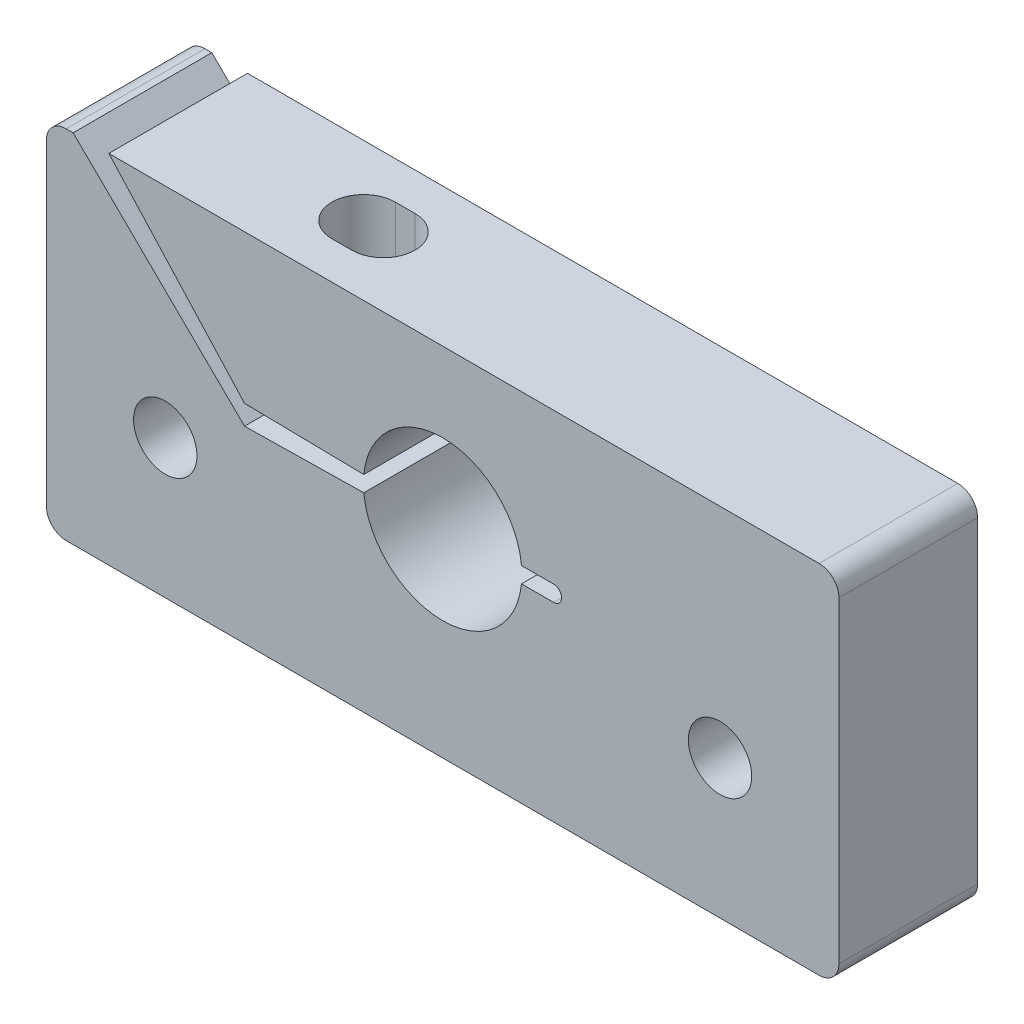
from build123d import *

# Parameters (mm, degrees)
BOSS_EXTRUDE1_DEPTH      = 3.5
BOSS_EXTRUDE1_DEPTH_BACK = 3.5
SKETCH1_R                = 1.6
CUT_EXTRUDE1_REACH       = 29.134
SKETCH3_R                = 1.6
SKETCH3_3_R              = 2.2
SKETCH3_3_R_2            = 1.6
CUT_EXTRUDE2_DEPTH       = 6
CUT_EXTRUDE3_REACH       = 29.134
FILLET1_R                = 1
FILLET2_R                = 0.4


with BuildPart() as part:
    # Sketch1 → Boss-Extrude1 (new, two sides: drawn at the far end of the back side and taken through both)
    with BuildSketch(Plane.XY.offset(-BOSS_EXTRUDE1_DEPTH_BACK)):
        with BuildLine():
            Line((-20, 8), (-18.64966284, 8))
            Line((-18.64966284, 8), (-10, -0.5))
            Line((-10, -0.5), (-3.979949748, -0.4))
            ThreePointArc((-3.979949748, -0.4), (0, -4), (3.979949748, -0.4))
            Line((3.979949748, -0.4), (6, -0.4))
            Line((6, -0.4), (6, 0.4))
            Line((6, 0.4), (3.979949748, 0.4))
            ThreePointArc((3.979949748, 0.4), (0, 4), (-3.979949748, 0.4))
            Line((-3.979949748, 0.4), (-10, 0.5))
            Line((-10, 0.5), (-16.848441102, 8))
            Line((-16.848441102, 8), (20, 8))
            Line((20, 8), (20, -10))
            Line((20, -10), (-20, -10))
            Line((-20, -10), (-20, 8))
        make_face()
        with Locations((-14, -3)):
            Circle(SKETCH1_R, mode=Mode.SUBTRACT)
        with Locations(Location((14, -3, 0), (0, 0, 180))):
            Circle(SKETCH1_R, mode=Mode.SUBTRACT)
    extrude(amount=BOSS_EXTRUDE1_DEPTH + BOSS_EXTRUDE1_DEPTH_BACK)

    # Cut-Extrude1: up to this plane
    cut_extrude1_end = Plane(origin=(-10, -0.5, -3.5), z_dir=(-0.016608865731892127, 0.9998620632762801, 0))
    # Sketch3 → Cut-Extrude1 (cut, up to the surface)
    with BuildSketch(Plane.XZ.offset(10), mode=Mode.PRIVATE) as cut_extrude1_sk1:
        with Locations(Location((-6.989974874, 0, 0), (0, 0, 270))):
            Circle(SKETCH3_R)
    cut_extrude1_tool1 = split(extrude(cut_extrude1_sk1.sketch, amount=-CUT_EXTRUDE1_REACH, mode=Mode.PRIVATE), bisect_by=cut_extrude1_end, keep=Keep.BOTH, mode=Mode.PRIVATE)
    add(cut_extrude1_tool1.solids().sort_by_distance((-6.989975, -10, 0))[0], mode=Mode.SUBTRACT)

    # Sketch3<3> → Cut-Extrude2 (cut)
    with BuildSketch(Plane.XZ.offset(10)):
        with Locations(Location((-6.989974874, 0, 0), (0, 0, 270))):
            Circle(SKETCH3_3_R)
        with Locations(Location((-6.989974874, 0, 0), (0, 0, 270))):
            Circle(SKETCH3_3_R_2, mode=Mode.SUBTRACT)
    extrude(amount=-CUT_EXTRUDE2_DEPTH, mode=Mode.SUBTRACT)

    # Cut-Extrude3: up to this plane
    cut_extrude3_end = Plane(origin=(-10, 0.5, -3.5), z_dir=(-0.016608865731892127, -0.9998620632762801, 0))
    # Sketch4 → Cut-Extrude3 (cut, up to the surface)
    with BuildSketch(Plane(origin=(0, 8, 0), x_dir=(1, 0, 0), z_dir=(0, 1, 0)), mode=Mode.PRIVATE) as cut_extrude3_sk1:
        with BuildLine():
            Line((-7.489974874, 1.6), (-6.489974874, 1.6))
            ThreePointArc((-6.489974874, 1.6), (-4.889974874, 0), (-6.489974874, -1.6))
            Line((-6.489974874, -1.6), (-7.489974874, -1.6))
            ThreePointArc((-7.489974874, -1.6), (-9.089974874, 0), (-7.489974874, 1.6))
        make_face()
    cut_extrude3_tool1 = split(extrude(cut_extrude3_sk1.sketch, amount=-CUT_EXTRUDE3_REACH, mode=Mode.PRIVATE), bisect_by=cut_extrude3_end, keep=Keep.BOTH, mode=Mode.PRIVATE)
    add(cut_extrude3_tool1.solids().sort_by_distance((-6.989975, 8, 0))[0], mode=Mode.SUBTRACT)

    # Fillet1
    fillet1_edges = [part.edges().sort_by_distance(p)[0] for p in [
        (20, 8, 0),
        (20, -10, 0),
        (-20, -10, 0),
        (-20, 8, 0),
    ]]
    fillet(fillet1_edges, radius=FILLET1_R)

    # Fillet2
    fillet2_edges = [part.edges().sort_by_distance(p)[0] for p in [
        (6, -0.4, 0),
        (6, 0.4, 0),
    ]]
    fillet(fillet2_edges, radius=FILLET2_R - 0.0001)  # a hair under: the kernel refuses the full size


solid = part.part
